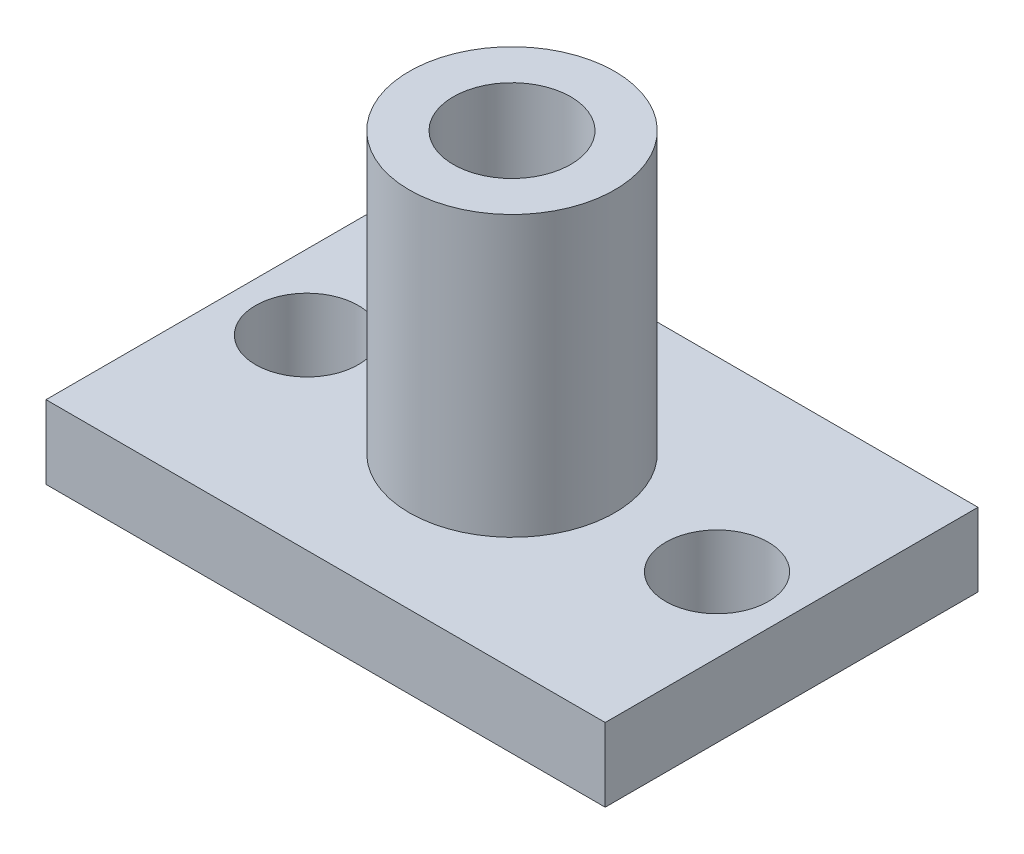
from build123d import *

# Parameters (mm, degrees)
SKETCH1_W           = 38.1
SKETCH1_H           = 25.4
BOSS_EXTRUDE1_DEPTH = 5
SKETCH3_R           = 7
SKETCH3_R_2         = 4
BOSS_EXTRUDE2_DEPTH = 19.05
SKETCH4_R           = 3.5
CUT_EXTRUDE1_DEPTH  = 35.525178946


with BuildPart() as part:
    # Sketch1 → Boss-Extrude1 (new body)
    with BuildSketch(Plane(origin=(0, 0, 0), x_dir=(1, 0, 0), z_dir=(0, 1, 0))):
        with Locations((-6.79173913, 0)):
            Rectangle(SKETCH1_W, SKETCH1_H)
    extrude(amount=BOSS_EXTRUDE1_DEPTH)

    # Sketch3 → Boss-Extrude2 (add)
    with BuildSketch(Plane(origin=(0, 5, 0), x_dir=(1, 0, 0), z_dir=(0, 1, 0))):
        with Locations((-6.79173913, 0)):
            Circle(SKETCH3_R)
        with Locations((-6.79173913, 0)):
            Circle(SKETCH3_R_2, mode=Mode.SUBTRACT)
    extrude(amount=BOSS_EXTRUDE2_DEPTH)

    # Sketch4 → Cut-Extrude1 (cut, through all)
    with BuildSketch(Plane(origin=(0, 5, 0), x_dir=(1, 0, 0), z_dir=(0, 1, 0))):
        with Locations((7.17826087, 0)):
            Circle(SKETCH4_R)
        with Locations((-20.76173913, 0)):
            Circle(SKETCH4_R)
    extrude(amount=-CUT_EXTRUDE1_DEPTH, mode=Mode.SUBTRACT)


solid = part.part
